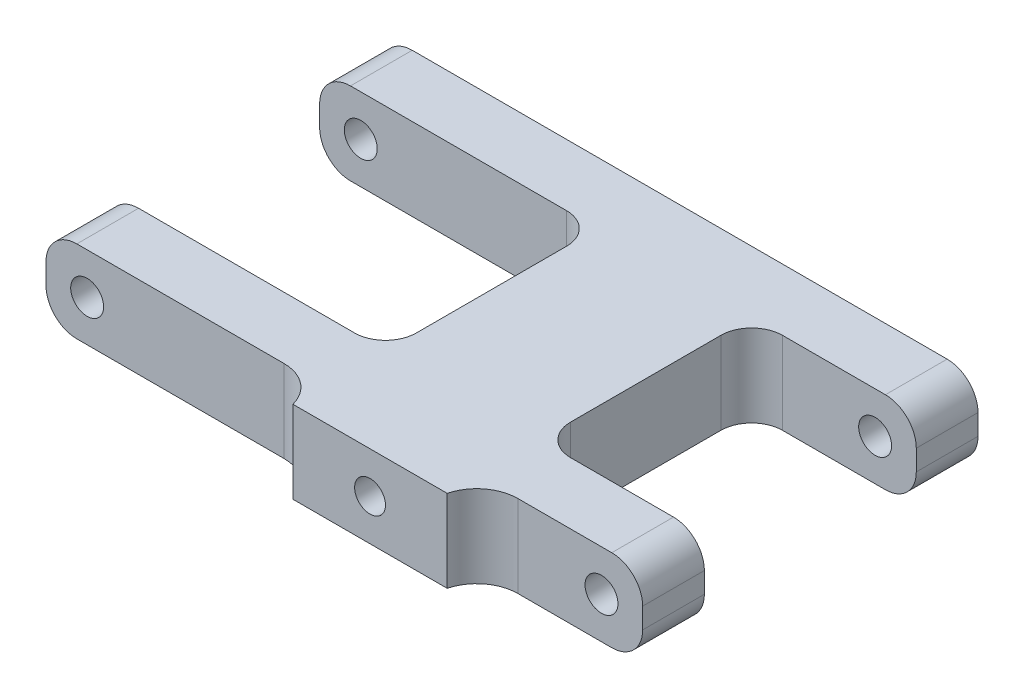
from build123d import *

# Parameters (mm, degrees)
SKETCH1_W               = 58
SKETCH1_H               = 32.6
BOSS_EXTRUDE1_DEPTH     = 8
SKETCH2_W               = 20.6
SKETCH2_H               = 8
CUT_EXTRUDE1_DEPTH      = 16
SKETCH3_W               = 20.6
SKETCH3_H               = 8
CUT_EXTRUDE2_DEPTH      = 27
SKETCH5_R               = 1.6
CUT_EXTRUDE4_DEPTH      = 68.013133041
FILLET1_R               = 3
FILLET2_R               = 3
SKETCH7_W               = 15
SKETCH7_H               = 8
BOSS_EXTRUDE2_DEPTH     = 3
CUT_EXTRUDE5_DEPTH      = 3
CUT_EXTRUDE5_DEPTH_BACK = 15
SKETCH6_R               = 1.5
FILLET3_R               = 4


with BuildPart() as part:
    # Sketch1 → Boss-Extrude1 (new body)
    with BuildSketch(Plane(origin=(0, 0, 0), x_dir=(1, 0, 0), z_dir=(0, 1, 0))):
        with Locations((29, -16.3)):
            Rectangle(SKETCH1_W, SKETCH1_H)
    extrude(amount=BOSS_EXTRUDE1_DEPTH)

    # Sketch2 → Cut-Extrude1 (cut)
    with BuildSketch(Plane(origin=(58, 0, 0), x_dir=(0, 0, -1), z_dir=(1, 0, 0))):
        with Locations((-16.3, 4)):
            Rectangle(SKETCH2_W, SKETCH2_H)
    extrude(amount=-CUT_EXTRUDE1_DEPTH, mode=Mode.SUBTRACT)

    # Sketch3 → Cut-Extrude2 (cut)
    with BuildSketch(Plane.ZY):
        with Locations((16.3, 4)):
            Rectangle(SKETCH3_W, SKETCH3_H)
    extrude(amount=-CUT_EXTRUDE2_DEPTH, mode=Mode.SUBTRACT)

    # Sketch5 → Cut-Extrude4 (cut, through all)
    with BuildSketch(Plane.XY.offset(32.6)):
        with Locations((4, 4)):
            Circle(SKETCH5_R)
        with Locations((54, 4)):
            Circle(SKETCH5_R)
    extrude(amount=-CUT_EXTRUDE4_DEPTH, mode=Mode.SUBTRACT)

    # Fillet1
    fillet1_edges = [part.edges().sort_by_distance(p)[0] for p in [
        (58, 8, 29.6),
        (58, 0, 3),
        (58, 8, 3),
        (0, 0, 29.6),
        (0, 8, 29.6),
        (0, 8, 3),
        (58, 0, 29.6),
        (0, 0, 3),
    ]]
    fillet(fillet1_edges, radius=FILLET1_R)

    # Fillet2
    fillet2_edges = [part.edges().sort_by_distance(p)[0] for p in [
        (42, 4, 26.6),
        (42, 4, 6),
        (27, 4, 6),
        (27, 4, 26.6),
    ]]
    fillet(fillet2_edges, radius=FILLET2_R)

    # Sketch7 → Boss-Extrude2 (add)
    with BuildSketch(Plane.XY.offset(32.6)):
        with Locations((34.5, 4)):
            Rectangle(SKETCH7_W, SKETCH7_H)
    extrude(amount=BOSS_EXTRUDE2_DEPTH)

    # Sketch6 → Cut-Extrude5 (cut, two sides: drawn at the far end of the back side and taken through both)
    with BuildSketch(Plane.XY.offset(32.6).offset(-CUT_EXTRUDE5_DEPTH_BACK)):
        with Locations((34.5, 4)):
            Circle(SKETCH6_R)
    extrude(amount=CUT_EXTRUDE5_DEPTH + CUT_EXTRUDE5_DEPTH_BACK, mode=Mode.SUBTRACT)

    # Fillet3
    # the kernel refuses this fillet: 4 mm, written as the material it adds along each edge
    with BuildSketch(Plane(origin=(42, 8, 32.6), x_dir=(0, 0, 1), z_dir=(0, -1, 0))) as fillet3_piece_1:
        with BuildLine():
            CenterArc((4, -3.872983346), FILLET3_R, 104.477512186, 75.522487814)
            Line((0, -3.872983346), (-0.08, -3.872983346))
            Line((-0.08, -3.872983346), (-0.08, 0))
            Line((-0.08, 0), (0, 0.08))
            ThreePointArc((0, 0.08), (1.5, 0.08), (2.98, 0.077459667))
            Line((2.98, 0.077459667), (3, 0))
        make_face()
    extrude(amount=8)
    with BuildSketch(Plane(origin=(27, 0, 32.6), x_dir=(-1, 0, 0), z_dir=(0, 1, 0))) as fillet3_piece_2:
        with BuildLine():
            CenterArc((3.872983346, 4), FILLET3_R, 194.477512186, 75.522487814)
            Line((0, 3), (-0.077459667, 2.98))
            ThreePointArc((-0.077459667, 2.98), (-0.08, 1.5), (-0.08, 0))
            Line((-0.08, 0), (0, -0.08))
            Line((0, -0.08), (3.872983346, -0.08))
            Line((3.872983346, -0.08), (3.872983346, 0))
        make_face()
    extrude(amount=8)


solid = part.part
